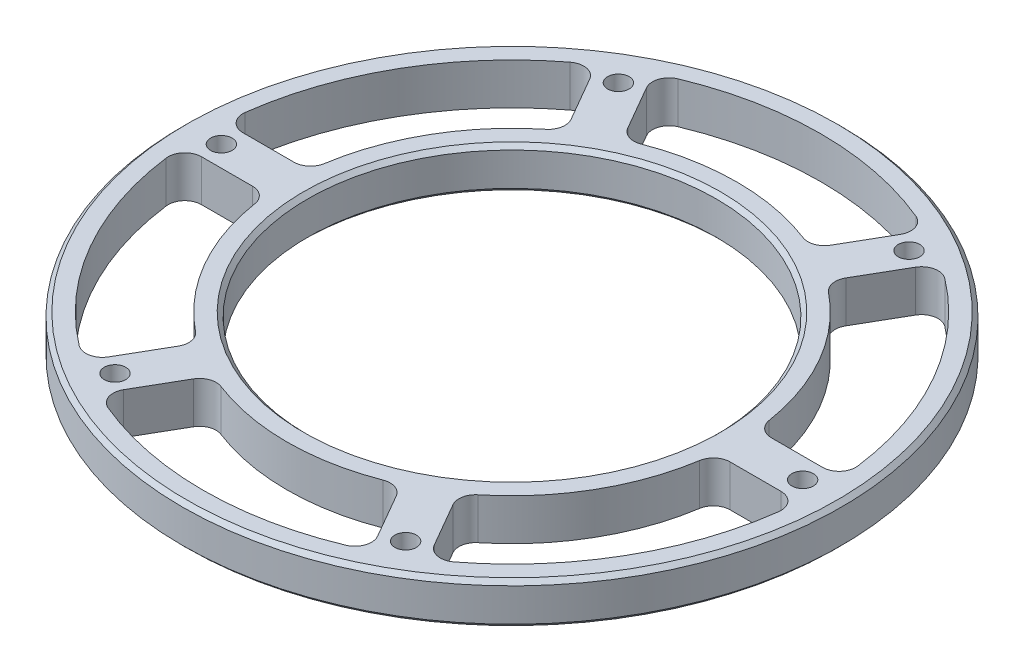
from build123d import *

# Parameters (mm, degrees)
F_6_0_204_DIAMETER_HOLE1_D = 5.1816
CIRPATTERN3_COUNT          = 6
CUT_EXTRUDE1_DEPTH         = 113.69774287890597
FILLET1_R                  = 4
CIRPATTERN4_COUNT          = 6
FILLET1_OF_CIRPATTERN4_R   = 4
CHAMFER1_SIZE              = 1
CHAMFER2_SIZE              = 1


with BuildPart() as part:
    # Sketch2 → Revolve1 (revolve)
    with BuildSketch(Plane(origin=(0, 0, 0), x_dir=(0, 0, -1), z_dir=(1, 0, 0))):
        Polygon((-49.2125, -4.7e-16), (-79.375, -3.69e-15), (-79.375, 9.999999999999996), (-49.2125, 9.999999999999995), align=None)
    revolve(axis=Axis((0, -0.500000000000003, 0), (0, 1, 0)))

    # #6 (0.204) Diameter Hole1 (through all)
    with Locations(Plane(origin=(0, 9.999999999999995, 0), x_dir=(1, 0, 0), z_dir=(0, 1, 0))):
        with Locations((-35, 60.621778265)):
            f_6_0_204_diameter_hole1 = Hole(F_6_0_204_DIAMETER_HOLE1_D / 2)

    # CirPattern3: #6 (0.204) Diameter Hole1 ×6 about axis
    cirpattern3_axis = Axis((0, -0.500000000000003, 0), (0, 1, 0))
    for i in range(1, CIRPATTERN3_COUNT):
        add(f_6_0_204_diameter_hole1.rotate(cirpattern3_axis, i * 360 / CIRPATTERN3_COUNT), mode=Mode.SUBTRACT)

    # Sketch8 → Cut-Extrude1 (cut, through all)
    with BuildSketch(Plane(origin=(0, 9.999999999999995, 0), x_dir=(1, 0, 0), z_dir=(0, 1, 0))):
        with BuildLine():
            Line((-22.660589701137386, 49.24929269184184), (-32.773244205941005, 66.76492409355195))
            ThreePointArc((-32.773244205941005, 66.76492409355195), (4.55e-15, 74.375), (32.773244205941005, 66.76492409355195))
            Line((32.773244205941005, 66.76492409355195), (22.660589701137386, 49.24929269184184))
            ThreePointArc((22.660589701137386, 49.24929269184184), (3.32e-15, 54.2125), (-22.660589701137386, 49.24929269184184))
        make_face()
    cut_extrude1 = extrude(amount=-CUT_EXTRUDE1_DEPTH, mode=Mode.SUBTRACT)

    # Fillet1
    fillet1_edges = [part.edges().sort_by_distance(p)[0] for p in [
        (-22.660589701137383, 4.999999999999997, -49.24929269184184),
        (22.66058970113739, 4.999999999999997, -49.249292691841845),
        (32.77324420594101, 4.999999999999997, -66.76492409355195),
        (-32.77324420594101, 4.999999999999997, -66.76492409355195),
    ]]
    fillet(fillet1_edges, radius=FILLET1_R)

    # CirPattern4: Cut-Extrude1 ×6 about axis
    cirpattern4_axis = Axis((0, -0.500000000000003, 0), (0, 1, 0))
    for i in range(1, CIRPATTERN4_COUNT):
        add(cut_extrude1.rotate(cirpattern4_axis, i * 360 / CIRPATTERN4_COUNT), mode=Mode.SUBTRACT)

    # Fillet1 of CirPattern4
    fillet1_of_cirpattern4_edges = [part.edges().sort_by_distance(p)[0] for p in [
        (-53.98143344011902, 4.999999999999997, -4.9999999999999325),
        (-31.320843738981637, 4.999999999999997, -44.24929269184193),
        (-41.43349824378521, 4.999999999999997, -61.76492409355206),
        (-74.20674244972624, 4.999999999999997, -4.999999999999908),
        (-31.32084373898165, 4.999999999999997, 44.2492926918419),
        (-53.981433440119034, 4.999999999999997, 4.999999999999911),
        (-74.20674244972622, 4.999999999999997, 4.999999999999883),
        (-41.43349824378523, 4.999999999999997, 61.76492409355204),
        (22.660589701137376, 4.999999999999997, 49.24929269184184),
        (-22.660589701137397, 4.999999999999997, 49.249292691841845),
        (-32.77324420594102, 4.999999999999997, 66.76492409355195),
        (32.773244205941005, 4.999999999999997, 66.76492409355195),
        (53.98143344011902, 4.999999999999997, 4.999999999999954),
        (31.320843738981615, 4.999999999999997, 44.24929269184194),
        (41.43349824378519, 4.999999999999997, 61.764924093552075),
        (74.20674244972622, 4.999999999999997, 4.999999999999936),
        (31.320843738981637, 4.999999999999997, -44.249292691841916),
        (53.981433440119034, 4.999999999999997, -4.9999999999999325),
        (74.20674244972624, 4.999999999999997, -4.999999999999908),
        (41.43349824378521, 4.999999999999997, -61.76492409355206),
    ]]
    fillet(fillet1_of_cirpattern4_edges, radius=FILLET1_OF_CIRPATTERN4_R)

    # Chamfer1
    chamfer1_edges = [part.edges().sort_by_distance(p)[0] for p in [
        (6.03e-15, 9.999999999999995, -49.2125),
        (6.03e-15, -4.4e-16, -49.2125),
    ]]
    chamfer(chamfer1_edges, length=CHAMFER1_SIZE)

    # Chamfer2
    chamfer2_edges = [part.edges().sort_by_distance(p)[0] for p in [
        (9.72e-15, 9.999999999999996, -79.375),
        (9.72e-15, -3.72e-15, -79.375),
    ]]
    chamfer(chamfer2_edges, length=CHAMFER2_SIZE)


solid = part.part
